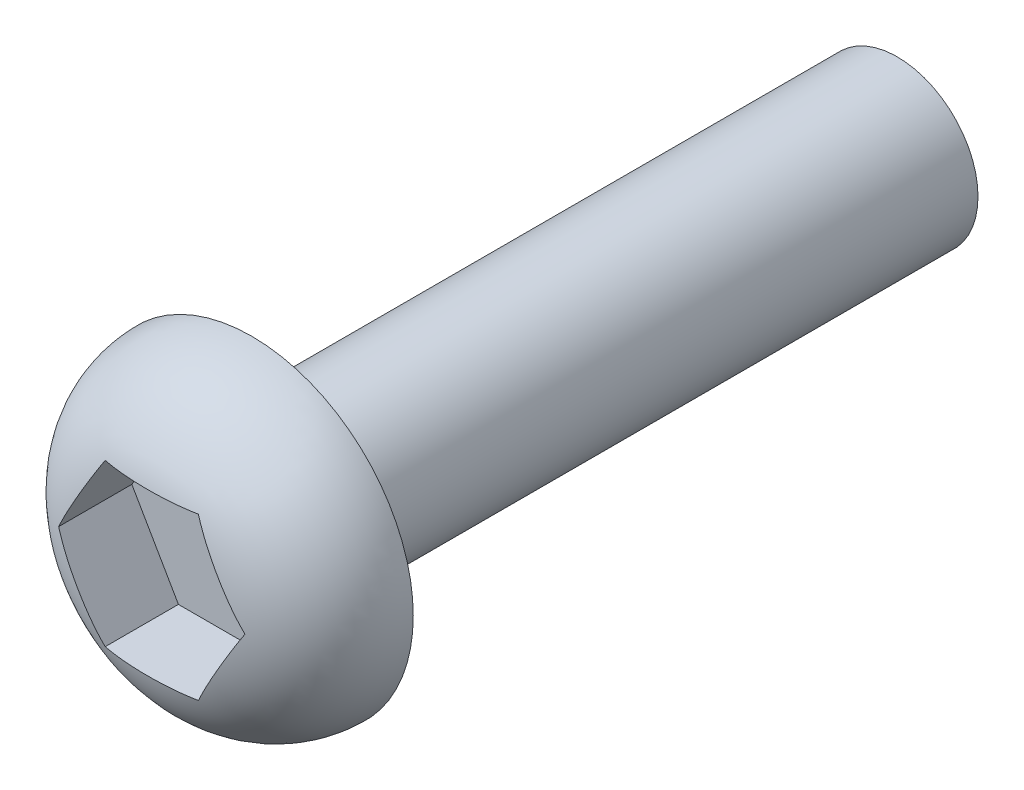
from build123d import *

# Parameters (mm, degrees)
SKETCH1_R           = 1.5
BOSS_EXTRUDE1_DEPTH = 12
SKETCH2_R           = 3
BOSS_EXTRUDE2_DEPTH = 2
CUT_EXTRUDE1_DEPTH  = 1.5
FILLET1_R           = 2


with BuildPart() as part:
    # Sketch1 → Boss-Extrude1 (new body)
    with BuildSketch(Plane.XY):
        Circle(SKETCH1_R)
    extrude(amount=BOSS_EXTRUDE1_DEPTH)

    # Sketch2 → Boss-Extrude2 (add)
    with BuildSketch(Plane.XY.offset(12)):
        Circle(SKETCH2_R)
    extrude(amount=BOSS_EXTRUDE2_DEPTH)

    # Sketch3 → Cut-Extrude1 (cut)
    with BuildSketch(Plane.XY.offset(14)):
        Polygon((-1.732050808, 0), (-0.866025404, -1.5), (0.866025404, -1.5), (1.732050808, 0), (0.866025404, 1.5), (-0.866025404, 1.5), align=None)
    extrude(amount=-CUT_EXTRUDE1_DEPTH, mode=Mode.SUBTRACT)

    # Fillet1
    # the kernel refuses this fillet: 2 mm, written as the material it takes off along each edge
    with BuildSketch(Plane(origin=(0, 0, 14), x_dir=(1, 0, 0), z_dir=(0, -1, 0))) as fillet1_piece_1:
        with BuildLine():
            CenterArc((3 - FILLET1_R, -FILLET1_R), FILLET1_R, 0, 90)
            Line((3 - FILLET1_R, 0), (3, 0))
            Line((3, 0), (3, -FILLET1_R))
        make_face()
    revolve(axis=Axis((0, 0, 14), (0, 0, 1)), mode=Mode.SUBTRACT)


solid = part.part
